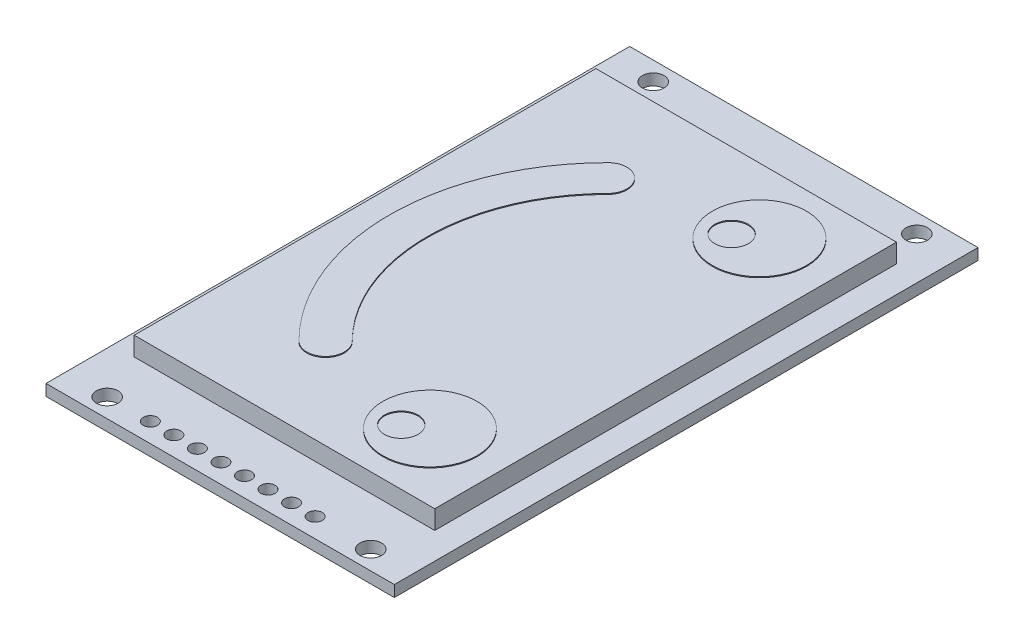
from build123d import *

# Parameters (mm, degrees)
SKETCH1_W           = 37
SKETCH1_H           = 62
SKETCH1_R           = 1.15
BOSS_EXTRUDE1_DEPTH = 1.2
SKETCH2_W           = 31.928778657
SKETCH2_H           = 49.046896963
BOSS_EXTRUDE2_DEPTH = 2
SKETCH3_R           = 0.75
CUT_EXTRUDE1_DEPTH  = 73.228803119
SKETCH4_R           = 5
SKETCH4_R_2         = 1.786053174
BOSS_EXTRUDE3_DEPTH = 0.1


with BuildPart() as part:
    # Sketch1 → Boss-Extrude1 (new body)
    with BuildSketch(Plane(origin=(0, 0, 0), x_dir=(1, 0, 0), z_dir=(0, 1, 0))):
        with Locations((18.5, 31)):
            Rectangle(SKETCH1_W, SKETCH1_H)
        with Locations((32.5, 60)):
            Circle(SKETCH1_R, mode=Mode.SUBTRACT)
        with Locations((4.5, 60)):
            Circle(SKETCH1_R, mode=Mode.SUBTRACT)
        with Locations((32.5, 2)):
            Circle(SKETCH1_R, mode=Mode.SUBTRACT)
        with Locations((4.5, 2)):
            Circle(SKETCH1_R, mode=Mode.SUBTRACT)
    extrude(amount=BOSS_EXTRUDE1_DEPTH)

    # Sketch2 → Boss-Extrude2 (add)
    with BuildSketch(Plane(origin=(0, 1.2, 0), x_dir=(1, 0, 0), z_dir=(0, 1, 0))):
        with Locations((18.2105599, 31.643941755)):
            Rectangle(SKETCH2_W, SKETCH2_H)
    extrude(amount=BOSS_EXTRUDE2_DEPTH)

    # Sketch3 → Cut-Extrude1 (cut, through all)
    with BuildSketch(Plane(origin=(0, 1.2, 0), x_dir=(1, 0, 0), z_dir=(0, 1, 0))):
        with Locations((9.031578358, 2.050688375)):
            Circle(SKETCH3_R)
        with Locations((11.531578358, 2.050688375)):
            Circle(SKETCH3_R)
        with Locations((14.031578358, 2.050688375)):
            Circle(SKETCH3_R)
        with Locations((16.531578358, 2.050688375)):
            Circle(SKETCH3_R)
        with Locations((19.031578358, 2.050688375)):
            Circle(SKETCH3_R)
        with Locations((21.531578358, 2.050688375)):
            Circle(SKETCH3_R)
        with Locations((24.031578358, 2.050688375)):
            Circle(SKETCH3_R)
        with Locations((26.531578358, 2.050688375)):
            Circle(SKETCH3_R)
    extrude(amount=-CUT_EXTRUDE1_DEPTH, mode=Mode.SUBTRACT)

    # Sketch4 → Boss-Extrude3 (add)
    # profile 1 of 3: a face of its own
    with BuildSketch(Plane(origin=(0, 3.2, 0), x_dir=(1, 0, 0), z_dir=(0, 1, 0))):
        with Locations((26.639884222, 49.143941754)):
            Circle(SKETCH4_R)
        with Locations((24.763300075, 48.058155317)):
            Circle(SKETCH4_R_2, mode=Mode.SUBTRACT)
    # profile 2 of 3: a face of its own
    with BuildSketch(Plane(origin=(0, 3.2, 0), x_dir=(1, 0, 0), z_dir=(0, 1, 0))):
        with Locations((26.639884222, 14.143941754)):
            Circle(SKETCH4_R)
        with Locations((24.763300075, 12.971685579)):
            Circle(SKETCH4_R_2, mode=Mode.SUBTRACT)
    # profile 3 of 3: a face of its own
    with BuildSketch(Plane(origin=(0, 3.2, 0), x_dir=(1, 0, 0), z_dir=(0, 1, 0))):
        with BuildLine():
            ThreePointArc((11.640146641, 48.058155317), (4.841156768, 31.643941754), (11.640146641, 15.229728192))
            ThreePointArc((11.640146641, 15.229728192), (14.468573766, 15.229728192), (14.468573766, 18.058155317))
            ThreePointArc((14.468573766, 18.058155317), (8.841156768, 31.643941754), (14.468573766, 45.229728192))
            ThreePointArc((14.468573766, 45.229728192), (14.468573766, 48.058155317), (11.640146641, 48.058155317))
        make_face()
    extrude(amount=BOSS_EXTRUDE3_DEPTH)


solid = part.part
